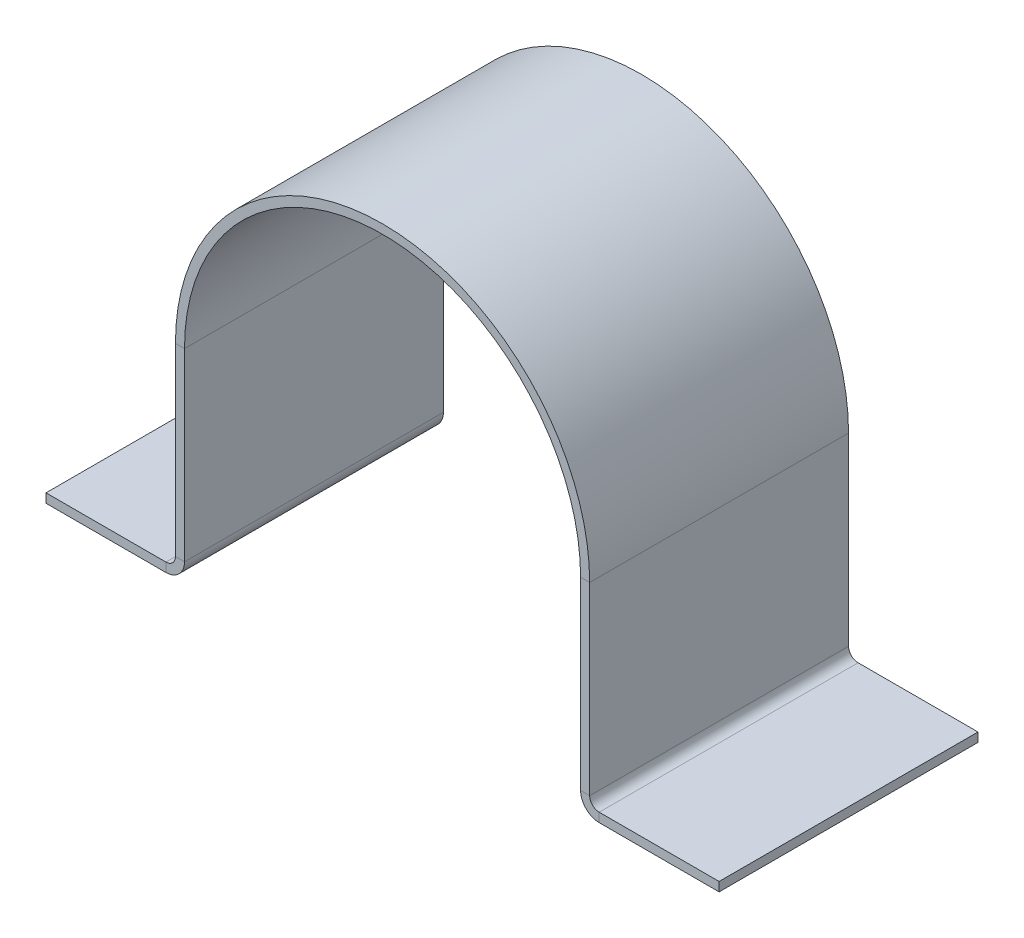
from build123d import *

# Parameters (mm, degrees)
BASE_FLANGE1_DEPTH = 20


# Sheet-metal steps are written as plain solids
with BuildPart() as part:
    # Base-Flange1: sheet metal written as solids
    # Sketch1 → Base-Flange1 (new body)
    with BuildSketch(Plane.XY):
        with BuildLine():
            Line((-24.427312775, 1.27753304), (-15.163912775, 1.27753304))
            ThreePointArc((-15.163912775, 1.27753304), (-14.64305792, 1.493278185), (-14.427312775, 2.01413304))
            Line((-14.427312775, 2.01413304), (-14.427312775, 16.27753304))
            ThreePointArc((-14.427312775, 16.27753304), (1.572687225, 32.27753304), (17.572687225, 16.27753304))
            Line((17.572687225, 16.27753304), (17.572687225, 2.01413304))
            ThreePointArc((17.572687225, 2.01413304), (17.78843237, 1.493278185), (18.309287225, 1.27753304))
            Line((18.309287225, 1.27753304), (27.572687225, 1.27753304))
            Line((27.572687225, 1.27753304), (27.572687225, 0.57753304))
            Line((27.572687225, 0.57753304), (18.309287225, 0.57753304))
            ThreePointArc((18.309287225, 0.57753304), (17.293457623, 0.998303438), (16.872687225, 2.01413304))
            Line((16.872687225, 2.01413304), (16.872687225, 16.27753304))
            ThreePointArc((16.872687225, 16.27753304), (1.572687225, 31.57753304), (-13.727312775, 16.27753304))
            Line((-13.727312775, 16.27753304), (-13.727312775, 2.01413304))
            ThreePointArc((-13.727312775, 2.01413304), (-14.148083173, 0.998303438), (-15.163912775, 0.57753304))
            Line((-15.163912775, 0.57753304), (-24.427312775, 0.57753304))
            Line((-24.427312775, 0.57753304), (-24.427312775, 1.27753304))
        make_face()
    extrude(amount=BASE_FLANGE1_DEPTH)


solid = part.part
